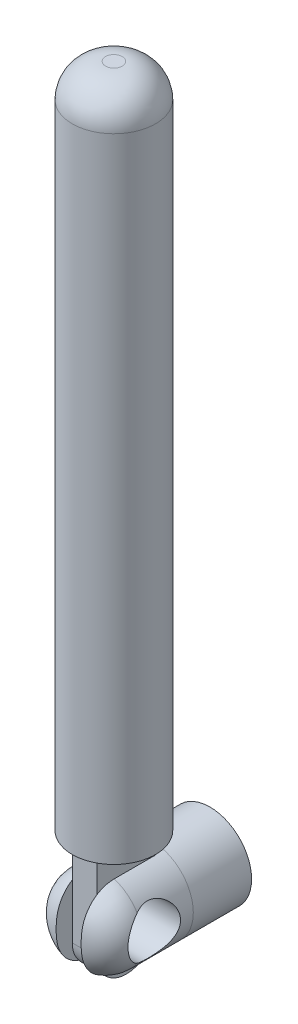
from build123d import *

# Parameters (mm, degrees)
SKETCH_1_R          = 5
EXTRUDE_1_DEPTH     = 7
SKETCH_3_R          = 5
EXTRUDE_3_DEPTH     = 10
FILLET_1_R          = 4
SKETCH_4_W          = 3
SKETCH_4_H          = 11.343584382
CUT_EXTRUDE_5_DEPTH = 9
SKETCH_5_R          = 3
CUT_EXTRUDE_6_DEPTH = 18.5
EXTRUDE_7_DEPTH     = 3
SKETCH_7_R          = 5
EXTRUDE_8_DEPTH     = 80
FILLET_2_R          = 4
SKETCH_8_R          = 3
CUT_EXTRUDE_9_DEPTH = 91.16797782


with BuildPart() as part:
    # Эскиз1 → Вытянуть1 (new body)
    with BuildSketch(Plane.XY):
        Circle(SKETCH_1_R)
    extrude(amount=EXTRUDE_1_DEPTH)


with BuildPart() as body_2:
    # Эскиз3 → Вытянуть3 (new body)
    with BuildSketch(Plane.XY.offset(7)):
        Circle(SKETCH_3_R)
    extrude(amount=EXTRUDE_3_DEPTH)

    # Скругление1
    fillet_1_edges = [body_2.edges().sort_by_distance(p)[0] for p in [
        (-5, 0, 17),
    ]]
    fillet(fillet_1_edges, radius=FILLET_1_R)

    # Эскиз4 → Вытянуть5 (cut)
    with BuildSketch(Plane.XY.offset(17)):
        Rectangle(SKETCH_4_W, SKETCH_4_H)
    extrude(amount=-CUT_EXTRUDE_5_DEPTH, mode=Mode.SUBTRACT)

    # Эскиз5 → Вытянуть6 (cut, symmetric)
    with BuildSketch(Plane(origin=(-1.5, 0, 0), x_dir=(0, 0, -1), z_dir=(1, 0, 0))):
        with Locations((-11.535811132, 0)):
            Circle(SKETCH_5_R)
    extrude(amount=CUT_EXTRUDE_6_DEPTH, both=True, mode=Mode.SUBTRACT)

    # Эскиз6 → Вытянуть7 (add)
    with BuildSketch(Plane(origin=(-1.5, 0, 0), x_dir=(0, 0, -1), z_dir=(1, 0, 0))):
        with BuildLine():
            Line((-15.035806814, -2.368679074), (-15.035806814, 8.31806101))
            Line((-15.035806814, 8.31806101), (-8.03581545, 8.31806101))
            Line((-8.03581545, 8.31806101), (-8.03581545, -2.357682884))
            ThreePointArc((-8.03581545, -2.357682884), (-11.530313037, -5.86317666), (-15.035806814, -2.368679074))
        make_face()
    extrude(amount=EXTRUDE_7_DEPTH)

    # Эскиз7 → Вытянуть8 (add)
    with BuildSketch(Plane(origin=(0, 8.31806101, 0), x_dir=(-1, 0, 0), z_dir=(0, 1, 0))):
        with Locations((0, 11.535811132)):
            Circle(SKETCH_7_R)
    extrude(amount=EXTRUDE_8_DEPTH)

    # Скругление2
    fillet_2_edges = [body_2.edges().sort_by_distance(p)[0] for p in [
        (5, 88.31806101, 11.535811132),
    ]]
    fillet(fillet_2_edges, radius=FILLET_2_R)

    # Эскиз8 → Вытянуть9 (cut, through all)
    with BuildSketch(Plane(origin=(1.5, 0, 0), x_dir=(0, 0, -1), z_dir=(1, 0, 0))):
        with Locations((-11.535811132, 0)):
            Circle(SKETCH_8_R)
    extrude(amount=-CUT_EXTRUDE_9_DEPTH, mode=Mode.SUBTRACT)


solid = Compound([part.part, body_2.part])
